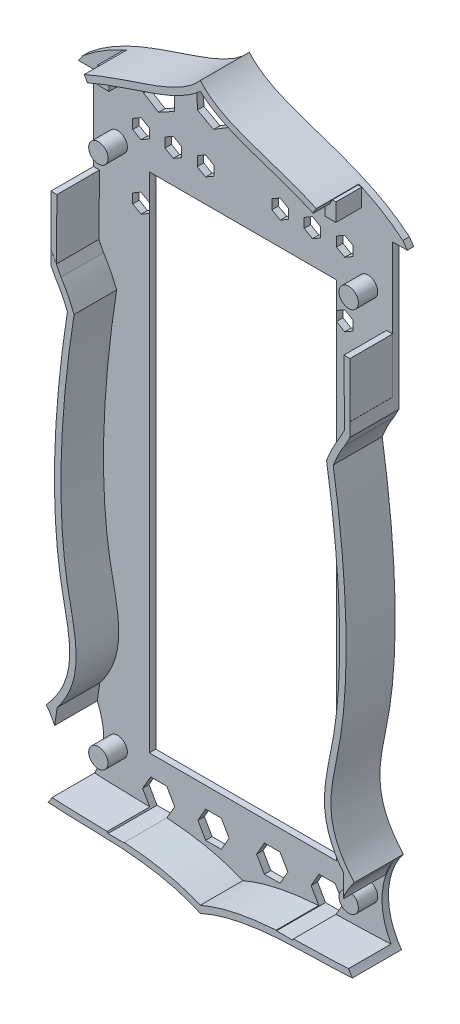
from build123d import *

# Parameters (mm, degrees)
CROQUIS1_R                = 1.5
SALIENTE_EXTRUIR1_DEPTH   = 7.6
SALIENTE_EXTRUIR1_2_DEPTH = 7.6
SALIENTE_EXTRUIR1_3_DEPTH = 7.6
SALIENTE_EXTRUIR1_4_DEPTH = 7.6
CROQUIS2_R                = 1.5
SALIENTE_EXTRUIR3_DEPTH   = 7.6
CROQUIS4_R                = 1.5
SALIENTE_EXTRUIR5_DEPTH   = 7.6
VACIADO2_START            = 1
VACIADO2_DEPTH            = 6.6
CROQUIS7_R                = 1.5
CROQUIS7_R_2              = 1.49758091
SALIENTE_EXTRUIR6_DEPTH   = 3
CROQUIS8_R                = 10.79265247
CROQUIS8_W                = 8.522992489
CROQUIS8_H                = 25
CORTAR_EXTRUIR2_DEPTH     = 7.6
CORTAR_EXTRUIR8_DEPTH     = 10
CROQUIS17_W               = 29
CROQUIS17_H               = 78
CORTAR_EXTRUIR9_DEPTH     = 10
CORTAR_EXTRUIR10_DEPTH    = 10
SALIENTE_EXTRUIR7_DEPTH   = 6.6
CROQUIS21_R               = 4.608681518
CORTAR_EXTRUIR12_DEPTH    = 6.6
SALIENTE_EXTRUIR17_DEPTH  = 6.6
CROQUIS34_W               = 1.681904755
CROQUIS34_H               = 2.752224693
SALIENTE_EXTRUIR33_DEPTH  = 4


# Read off the part's stored shape, not the designer's step: Vaciado2, Saliente-Extruir7
with BuildPart() as part:
    # Croquis1 → Saliente-Extruir1 (new body)
    with BuildSketch(Plane.XY):
        with Locations(Location((-19.405274038, 90.600927816, 0), (0, 0, 180))):
            Circle(CROQUIS1_R)
    extrude(amount=SALIENTE_EXTRUIR1_DEPTH)



with BuildPart() as body_2:
    # Croquis1 → Saliente-Extruir1 2 (new body)
    with BuildSketch(Plane.XY):
        with Locations(Location((19.405274038, 90.600927816, 0), (0, 0, 180))):
            Circle(CROQUIS1_R)
    extrude(amount=SALIENTE_EXTRUIR1_2_DEPTH)


with BuildPart() as body_3:
    # Croquis1 → Saliente-Extruir1 3 (new body)
    with BuildSketch(Plane.XY):
        with Locations(Location((-19.405274038, 9.399072184, 0), (0, 0, 180))):
            Circle(CROQUIS1_R)
    extrude(amount=SALIENTE_EXTRUIR1_3_DEPTH)


with BuildPart() as body_4:
    # Croquis1 → Saliente-Extruir1 4 (new body)
    with BuildSketch(Plane.XY):
        with Locations(Location((19.405274038, 9.399072184, 0), (0, 0, 180))):
            Circle(CROQUIS1_R)
    extrude(amount=SALIENTE_EXTRUIR1_4_DEPTH)


with BuildPart() as part_1:
    add(part.part)

    add(body_2.part)  # Saliente-Extruir3 merges body 2

    add(body_3.part)  # Saliente-Extruir3 merges body 3

    add(body_4.part)  # Saliente-Extruir3 merges body 4
    # Croquis2 → Saliente-Extruir3 (add)
    with BuildSketch(Plane.XY):
        with BuildLine():
            add(Edge.make_bspline(
                [(22.455196169, 74.097219878), (27.382232592, 83.429210928), (31.452765101, 90.387198949), (24.812211747, 99.439944374)],
                knots=[0.11050123, 0.11050123, 0.11050123, 0.11050123, 1, 1, 1, 1], degree=3))
            add(Edge.make_bspline(
                [(24.812211747, 99.439944374), (19.546217676, 103.828603356), (13.196463519, 105.432658494), (7.982243875, 107.269620004)],
                knots=[0.143181588, 0.143181588, 0.143181588, 0.143181588, 0.667562578, 0.667562578, 0.667562578, 0.667562578], degree=3))
            add(Edge.make_bspline(
                [(7.982243875, 107.269620004), (4.676628748, 108.434183097), (1.82739327, 109.692352969), (0, 111.812972587)],
                knots=[0.667562578, 0.667562578, 0.667562578, 0.667562578, 1, 1, 1, 1], degree=3))
            add(Edge.make_bspline(
                [(-24.812211747, 99.439944374), (-16.20777955, 106.610844709), (-4.709891542, 106.34732457), (0, 111.812972587)],
                knots=[0.143181588, 0.143181588, 0.143181588, 0.143181588, 1, 1, 1, 1], degree=3))
            add(Edge.make_bspline(
                [(-22.455196169, 74.097219878), (-27.382232592, 83.429210928), (-31.452765101, 90.387198949), (-24.812211747, 99.439944374)],
                knots=[0.11050123, 0.11050123, 0.11050123, 0.11050123, 1, 1, 1, 1], degree=3))
            add(Edge.make_bspline(
                [(-20.598197411, 70.500838285), (-21.096700712, 71.754083237), (-21.715700298, 72.952877102), (-22.455196169, 74.097219878)],
                knots=[0, 0, 0, 0, 0.196602836, 0.196602836, 0.196602836, 0.196602836], degree=3))
            add(Edge.make_bspline(
                [(-20.598197411, 70.500838285), (-22.806077443, 56.38679111), (-23.712592366, 31.871562699), (-16.869162928, 19.002842012), (-32.36, 9.399072184)],
                knots=[0, 0, 0, 0, 0.531906399, 1, 1, 1, 1], degree=3))
            add(Edge.make_bspline(
                [(-32.36, 9.399072184), (-32.279689687, 9.063611104), (-32.271111782, 8.890138206), (-32.283656965, 8.784699047)],
                knots=[0, 0, 0, 0, 0.017953112, 0.017953112, 0.017953112, 0.017953112], degree=3))
            add(Edge.make_bspline(
                [(-32.283656965, 8.784699047), (-32.244249538, 8.539703287), (-32.195140923, 8.305169613), (-32.136632945, 8.080637595)],
                knots=[0.019645113, 0.019645113, 0.019645113, 0.019645113, 0.043967189, 0.043967189, 0.043967189, 0.043967189], degree=3))
            add(Edge.make_bspline(
                [(-32.136632945, 8.080637595), (-29.836847948, -0.745088125), (-13.014518395, 5.882306702), (0, 0)],
                knots=[0.043967189, 0.043967189, 0.043967189, 0.043967189, 1, 1, 1, 1], degree=3))
            add(Edge.make_bspline(
                [(32.136632945, 8.080637595), (29.836847948, -0.745088125), (13.014518395, 5.882306702), (0, 0)],
                knots=[0.043967189, 0.043967189, 0.043967189, 0.043967189, 1, 1, 1, 1], degree=3))
            add(Edge.make_bspline(
                [(32.283656965, 8.784699047), (32.244249538, 8.539703287), (32.195140923, 8.305169613), (32.136632945, 8.080637595)],
                knots=[0.019645113, 0.019645113, 0.019645113, 0.019645113, 0.043967189, 0.043967189, 0.043967189, 0.043967189], degree=3))
            add(Edge.make_bspline(
                [(32.36, 9.399072184), (32.279689687, 9.063611104), (32.271111782, 8.890138206), (32.283656965, 8.784699047)],
                knots=[0, 0, 0, 0, 0.017953112, 0.017953112, 0.017953112, 0.017953112], degree=3))
            add(Edge.make_bspline(
                [(20.598197411, 70.500838285), (22.806077443, 56.38679111), (23.712592366, 31.871562699), (16.869162928, 19.002842012), (32.36, 9.399072184)],
                knots=[0, 0, 0, 0, 0.531906399, 1, 1, 1, 1], degree=3))
            add(Edge.make_bspline(
                [(20.598197411, 70.500838285), (21.096700712, 71.754083237), (21.715700298, 72.952877102), (22.455196169, 74.097219878)],
                knots=[0, 0, 0, 0, 0.196602836, 0.196602836, 0.196602836, 0.196602836], degree=3))
        make_face()
        with Locations((-19.405274038, 9.399072184)):
            Circle(CROQUIS2_R, mode=Mode.SUBTRACT)
        with Locations((19.405274038, 9.399072184)):
            Circle(CROQUIS2_R, mode=Mode.SUBTRACT)
        with Locations((-19.405274038, 90.600927816)):
            Circle(CROQUIS2_R, mode=Mode.SUBTRACT)
        with Locations((19.405274038, 90.600927816)):
            Circle(CROQUIS2_R, mode=Mode.SUBTRACT)
    extrude(amount=SALIENTE_EXTRUIR3_DEPTH)

    # Croquis4 → Saliente-Extruir5 (add)
    with BuildSketch(Plane(origin=(0, 0, 0), x_dir=(-1, 0, 0), z_dir=(0, 0, -1))):
        with Locations((19.405274038, 90.600927816)):
            Circle(CROQUIS4_R)
        with Locations((-19.405274038, 90.600927816)):
            Circle(CROQUIS4_R)
        with Locations((-19.405274038, 9.399072184)):
            Circle(CROQUIS4_R)
        with Locations((19.405274038, 9.399072184)):
            Circle(CROQUIS4_R)
    extrude(amount=-SALIENTE_EXTRUIR5_DEPTH)

    # Vaciado2 outline → Vaciado2 (cut)
    with BuildSketch(Plane.XY.offset(VACIADO2_START)):
        with BuildLine():
            add(Edge.make_bspline(
                [(-31.279137935, 8.896036325), (-31.279082677, 8.89183198), (-31.279037103, 8.887629763), (-31.279001254, 8.88342963), (-31.278975175, 8.879231542), (-31.27895891, 8.875035464), (-31.278952503, 8.870841364), (-31.278956, 8.866649215), (-31.278969444, 8.862458998), (-31.278992881, 8.858270694), (-31.279026354, 8.854084293), (-31.279069907, 8.849899788), (-31.279123586, 8.845717179), (-31.279187434, 8.84153647)],
                knots=[0.013264992, 0.013264992, 0.013264992, 0.013264992, 0.013264992, 0.013264992, 0.013264992, 0.013264992, 0.013264992, 0.013264992, 0.013264992, 0.013264992, 0.013264992, 0.013264992, 0.014365675, 0.014365675, 0.014365675, 0.014365675, 0.014365675, 0.014365675, 0.014365675, 0.014365675, 0.014365675, 0.014365675, 0.014365675, 0.014365675, 0.014365675, 0.014365675], degree=13))
            add(Edge.make_bspline(
                [(-31.279187434, 8.84153647), (-31.184785479, 8.304627377), (-31.052659192, 7.823290015), (-30.886295719, 7.39391882), (-30.688986145, 7.011623497), (-30.463051191, 6.669915736), (-30.209409951, 6.360597228), (-29.922493784, 6.075444188), (-29.59909728, 5.81414048), (-29.23769003, 5.574591877), (-28.837753494, 5.356716579), (-27.916545254, 4.942732127), (-27.386984927, 4.751241082), (-26.811924124, 4.58485512), (-26.193605714, 4.442894933), (-25.534827878, 4.323986191), (-24.838457409, 4.226117879), (-24.10724627, 4.146912092), (-23.343809085, 4.083820112), (-22.550655981, 4.034151108), (-21.730212019, 3.995031245), (-19.226585226, 3.901899168), (-17.472301083, 3.869713033), (-15.639455188, 3.845106125), (-13.744313735, 3.805138732), (-11.802225927, 3.726508076), (-9.828177295, 3.58568255), (-7.836867987, 3.358782953), (-5.84275346, 3.021348823), (-3.860690706, 2.54816815), (-1.907111986, 1.913562451), (-3.3e-08, 1.092906333)],
                knots=[0.023520973, 0.023520973, 0.023520973, 0.023520973, 0.023520973, 0.023520973, 0.023520973, 0.023520973, 0.023520973, 0.023520973, 0.023520973, 0.023520973, 0.25, 0.25, 0.25, 0.25, 0.25, 0.25, 0.25, 0.25, 0.25, 0.25, 0.5, 0.5, 0.5, 0.5, 0.5, 0.5, 0.5, 0.5, 0.5, 0.5, 0.99034932, 0.99034932, 0.99034932, 0.99034932, 0.99034932, 0.99034932, 0.99034932, 0.99034932, 0.99034932, 0.99034932, 0.99034932, 0.99034932], degree=11))
            add(Edge.make_bspline(
                [(31.279187161, 8.841536397), (31.184785479, 8.304627377), (31.052659192, 7.823290015), (30.886295719, 7.39391882), (30.688986145, 7.011623497), (30.463051191, 6.669915736), (30.209409951, 6.360597228), (29.922493784, 6.075444188), (29.59909728, 5.81414048), (29.23769003, 5.574591877), (28.837753494, 5.356716579), (27.916545254, 4.942732127), (27.386984927, 4.751241082), (26.811924124, 4.58485512), (26.193605714, 4.442894933), (25.534827878, 4.323986191), (24.838457409, 4.226117879), (24.10724627, 4.146912092), (23.343809085, 4.083820112), (22.550655981, 4.034151108), (21.730212019, 3.995031245), (19.226585226, 3.901899168), (17.472301083, 3.869713033), (15.639455188, 3.845106125), (13.744313735, 3.805138732), (11.802225927, 3.726508076), (9.828177295, 3.58568255), (7.836867987, 3.358782953), (5.84275346, 3.021348823), (3.860690706, 2.54816815), (1.907111986, 1.913562451), (-3.3e-08, 1.092906333)],
                knots=[0.023520973, 0.023520973, 0.023520973, 0.023520973, 0.023520973, 0.023520973, 0.023520973, 0.023520973, 0.023520973, 0.023520973, 0.023520973, 0.023520973, 0.25, 0.25, 0.25, 0.25, 0.25, 0.25, 0.25, 0.25, 0.25, 0.25, 0.5, 0.5, 0.5, 0.5, 0.5, 0.5, 0.5, 0.5, 0.5, 0.5, 0.99034932, 0.99034932, 0.99034932, 0.99034932, 0.99034932, 0.99034932, 0.99034932, 0.99034932, 0.99034932, 0.99034932, 0.99034932, 0.99034932], degree=11))
            add(Edge.make_bspline(
                [(31.279137935, 8.896036325), (31.279082677, 8.89183198), (31.279037103, 8.887629763), (31.279001254, 8.88342963), (31.278975175, 8.879231542), (31.27895891, 8.875035464), (31.278952503, 8.870841364), (31.278956, 8.866649215), (31.278969444, 8.862458998), (31.278992881, 8.858270694), (31.279026354, 8.854084293), (31.279069907, 8.849899788), (31.279123586, 8.845717179), (31.279187161, 8.841536397)],
                knots=[0.013264992, 0.013264992, 0.013264992, 0.013264992, 0.013264992, 0.013264992, 0.013264992, 0.013264992, 0.013264992, 0.013264992, 0.013264992, 0.013264992, 0.013264992, 0.013264992, 0.014365675, 0.014365675, 0.014365675, 0.014365675, 0.014365675, 0.014365675, 0.014365675, 0.014365675, 0.014365675, 0.014365675, 0.014365675, 0.014365675, 0.014365675, 0.014365675], degree=13))
            add(Edge.make_bspline(
                [(19.567958248, 70.616401553), (19.569188032, 70.608540065), (19.570417815, 70.600678576), (19.571647599, 70.592817088), (19.572877383, 70.5849556), (19.574107166, 70.577094111), (19.57533695, 70.569232623), (19.576566733, 70.561371134), (19.577796517, 70.553509646), (19.5790263, 70.545648157), (19.580256084, 70.537786669), (19.581485867, 70.529925181), (19.582715651, 70.522063692), (19.585835033, 70.502122795), (19.587724632, 70.490043387), (19.589614231, 70.477963979), (19.591503829, 70.46588457), (19.593393428, 70.453805162), (19.595283026, 70.441725753), (19.597172625, 70.429646345), (19.599062224, 70.417566936), (19.600951823, 70.405487528), (19.602841421, 70.39340812), (19.60473102, 70.381328711), (19.606620619, 70.369249303), (19.608746417, 70.355659968), (19.608981556, 70.35415678), (19.609226992, 70.35258813), (19.609423458, 70.351331085), (19.609767924, 70.349131451), (19.609802434, 70.348907705), (19.610299479, 70.345732462), (19.610306849, 70.345685341), (19.610674178, 70.343336123), (19.610858026, 70.342161332), (19.611105269, 70.340580312), (19.611338781, 70.339087249), (19.611808654, 70.336082674), (19.612043576, 70.334580396), (19.612278484, 70.333078127), (19.612513377, 70.331575867), (19.612748257, 70.330073616), (19.612983122, 70.328571375), (19.613217973, 70.327069141), (19.61345281, 70.325566918), (19.613687632, 70.324064702), (19.613922441, 70.322562497), (19.614157235, 70.3210603), (19.614392015, 70.319558112), (19.615096312, 70.315051576), (19.615565786, 70.312047255), (19.616035204, 70.30904297), (19.616504564, 70.30603872), (19.616973869, 70.303034508), (19.617443115, 70.300030329), (19.617912306, 70.297026191), (19.618381438, 70.294022085), (19.618850515, 70.291018018), (19.619319534, 70.288013985), (19.619788496, 70.28500999), (19.620257402, 70.28200603), (19.621663947, 70.272994259), (19.622601417, 70.266986557), (19.623538659, 70.260979), (19.624475673, 70.254971587), (19.625412459, 70.248964321), (19.626349018, 70.242957197), (19.627285349, 70.236950221), (19.628221452, 70.230943388), (19.629157328, 70.224936702), (19.630092976, 70.218930159), (19.631028396, 70.212923763), (19.631963589, 70.206917511), (19.636638412, 70.176886982), (19.640374627, 70.152864884), (19.644107197, 70.128845116), (19.647836121, 70.104827678), (19.6515614, 70.080812579), (19.655283032, 70.056799815), (19.659001016, 70.032789396), (19.662715352, 70.00878132), (19.66642604, 69.984775594), (19.670133079, 69.960772218), (19.673836467, 69.936771198), (19.677536205, 69.912772536), (19.696016636, 69.792791032), (19.71074256, 69.696843609), (19.72541002, 69.600934174), (19.740018974, 69.505062932), (19.754569381, 69.40923009), (19.769061197, 69.313435856), (19.783494381, 69.217680434), (19.797868891, 69.121964034), (19.812184684, 69.026286858), (19.826441718, 68.930649117), (19.840639951, 68.835051014), (19.854779341, 68.739492757), (19.897020856, 68.452938145), (19.924946323, 68.262061945), (19.952635913, 68.071347607), (19.980089287, 67.880796785), (20.007306111, 67.690411134), (20.034286047, 67.500192307), (20.061028761, 67.310141961), (20.087533915, 67.120261746), (20.113801174, 66.93055332), (20.1398302, 66.741018334), (20.165620659, 66.551658445), (20.191172214, 66.362475306), (20.267109156, 65.795461101), (20.3167768, 65.418165209), (20.365484792, 65.041596166), (20.413230463, 64.665767242), (20.460011147, 64.290691714), (20.505824175, 63.916382846), (20.550666881, 63.542853919), (20.594536595, 63.170118196), (20.637430651, 62.798188955), (20.679346381, 62.427079463), (20.720281118, 62.056802995), (20.760232192, 61.687372821), (20.877126429, 60.581661), (20.951110793, 59.847958329), (21.021128763, 59.117800542), (21.087159164, 58.391294115), (21.149180916, 57.668545663), (21.207173033, 56.949661937), (21.261114624, 56.234749827), (21.310984892, 55.523916355), (21.356763133, 54.817268687), (21.398428738, 54.114914121), (21.435961193, 53.416960094), (21.469340077, 52.72351418), (21.556955034, 50.65702391), (21.598668451, 49.297827409), (21.62352549, 47.957956805), (21.631366857, 46.638277208), (21.622034977, 45.339657005), (21.595375171, 44.062968234), (21.551236844, 42.809086984), (21.489474664, 41.578893761), (21.409949749, 40.373273888), (21.312530846, 39.193117874), (21.197095517, 38.03932181), (21.063531322, 36.912787744), (20.892762707, 35.677128611), (20.873503561, 35.540273297), (20.853959386, 35.403859908), (20.834130008, 35.267890223), (20.814015253, 35.132366021), (20.793614946, 34.997289082), (20.772928915, 34.862661184), (20.751956986, 34.728484108), (20.730698984, 34.594759631), (20.709154736, 34.461489534), (20.687324067, 34.328675595), (20.665206804, 34.196319595), (20.637201766, 34.03144924), (20.631583088, 33.998504951), (20.625945459, 33.965585522), (20.620291163, 33.932698117), (20.614619336, 33.899844604), (20.608928032, 33.867013115), (20.603218005, 33.83420241), (20.597492064, 33.801430142), (20.591750372, 33.76870411), (20.585988195, 33.735995571), (20.580202507, 33.703276398), (20.574401595, 33.670598507), (20.562761439, 33.605272254), (20.556922988, 33.572628687), (20.551066486, 33.540004558), (20.545192255, 33.507399747), (20.539300616, 33.474814131), (20.533391893, 33.442247592), (20.527466407, 33.409700006), (20.52152448, 33.377171255), (20.515566435, 33.344661216), (20.509592593, 33.312169769), (20.503603277, 33.279696793), (20.497598808, 33.247242167), (20.479540912, 33.149932976), (20.467442963, 33.0851331), (20.45528827, 33.020405176), (20.443079439, 32.955748236), (20.430819077, 32.891161314), (20.418509791, 32.826643442), (20.406154186, 32.762193655), (20.39375487, 32.697810985), (20.381314449, 32.633494466), (20.368835529, 32.56924313), (20.356320717, 32.505056011), (20.34377262, 32.440932142), (20.28087874, 32.120624214), (20.23007337, 31.865374194), (20.178946026, 31.611058787), (20.12766613, 31.3576159), (20.07640435, 31.104983095), (20.025332719, 30.853097621), (19.974624751, 30.601896449), (19.92445556, 30.351316306), (19.875001975, 30.101293706), (19.826442661, 29.851764988), (19.778958232, 29.602666346), (19.732731373, 29.353933866), (19.598378113, 28.608642943), (19.514577669, 28.112993447), (19.438029651, 27.618040232), (19.370246083, 27.123283135), (19.312779083, 26.628229959), (19.267227623, 26.132405529), (19.235238335, 25.635371124), (19.218499772, 25.136748959), (19.21872948, 24.636246286), (19.237653339, 24.133673808), (19.276976488, 23.628952977), (19.338345294, 23.122106848), (19.589452338, 21.617973518), (19.845836756, 20.61493075), (20.204002349, 19.604874933), (20.674307426, 18.589103249), (21.264980322, 17.570068405), (21.981859608, 16.5467718), (22.831920865, 15.515155122), (23.824450535, 14.470427225), (24.969383903, 13.408087735), (26.276568567, 12.323698346), (27.756846496, 11.212883515), (29.420782705, 10.071628583), (31.279137935, 8.896036325)],
                knots=[-0.003393214, -0.003393214, -0.003393214, -0.003393214, -0.003393214, -0.003393214, -0.003393214, -0.003393214, -0.003393214, -0.003393214, -0.003393214, -0.003393214, -0.003393214, -0.003393214, -0.002109375, -0.002109375, -0.002109375, -0.002109375, -0.002109375, -0.002109375, -0.002109375, -0.002109375, -0.002109375, -0.002109375, -0.002109375, -0.002109375, -0.000136719, -0.000136719, -0.000136719, -0.000136719, -0.000136719, -0.000136719, -0.000136719, -0.000136719, -0.000136719, -0.000136719, -0.000136719, -0.000136719, 0.000109863, 0.000109863, 0.000109863, 0.000109863, 0.000109863, 0.000109863, 0.000109863, 0.000109863, 0.000109863, 0.000109863, 0.000109863, 0.000109863, 0.000356445, 0.000356445, 0.000356445, 0.000356445, 0.000356445, 0.000356445, 0.000356445, 0.000356445, 0.000356445, 0.000356445, 0.000356445, 0.000356445, 0.000849609, 0.000849609, 0.000849609, 0.000849609, 0.000849609, 0.000849609, 0.000849609, 0.000849609, 0.000849609, 0.000849609, 0.000849609, 0.000849609, 0.001835937, 0.001835937, 0.001835937, 0.001835937, 0.001835937, 0.001835937, 0.001835937, 0.001835937, 0.001835937, 0.001835937, 0.001835937, 0.001835937, 0.00578125, 0.00578125, 0.00578125, 0.00578125, 0.00578125, 0.00578125, 0.00578125, 0.00578125, 0.00578125, 0.00578125, 0.00578125, 0.00578125, 0.0215625, 0.0215625, 0.0215625, 0.0215625, 0.0215625, 0.0215625, 0.0215625, 0.0215625, 0.0215625, 0.0215625, 0.0215625, 0.0215625, 0.053125, 0.053125, 0.053125, 0.053125, 0.053125, 0.053125, 0.053125, 0.053125, 0.053125, 0.053125, 0.053125, 0.053125, 0.11625, 0.11625, 0.11625, 0.11625, 0.11625, 0.11625, 0.11625, 0.11625, 0.11625, 0.11625, 0.11625, 0.11625, 0.2425, 0.2425, 0.2425, 0.2425, 0.2425, 0.2425, 0.2425, 0.2425, 0.2425, 0.2425, 0.2425, 0.2425, 0.495, 0.495, 0.495, 0.495, 0.495, 0.495, 0.495, 0.495, 0.495, 0.495, 0.495, 0.495, 0.5265625, 0.5265625, 0.5265625, 0.5265625, 0.5265625, 0.5265625, 0.5265625, 0.5265625, 0.5265625, 0.5265625, 0.5265625, 0.5265625, 0.534453125, 0.534453125, 0.534453125, 0.534453125, 0.534453125, 0.534453125, 0.534453125, 0.534453125, 0.534453125, 0.534453125, 0.534453125, 0.534453125, 0.54234375, 0.54234375, 0.54234375, 0.54234375, 0.54234375, 0.54234375, 0.54234375, 0.54234375, 0.54234375, 0.54234375, 0.54234375, 0.54234375, 0.558125, 0.558125, 0.558125, 0.558125, 0.558125, 0.558125, 0.558125, 0.558125, 0.558125, 0.558125, 0.558125, 0.558125, 0.62125, 0.62125, 0.62125, 0.62125, 0.62125, 0.62125, 0.62125, 0.62125, 0.62125, 0.62125, 0.62125, 0.62125, 0.7475, 0.7475, 0.7475, 0.7475, 0.7475, 0.7475, 0.7475, 0.7475, 0.7475, 0.7475, 0.7475, 0.7475, 0.994417885, 0.994417885, 0.994417885, 0.994417885, 0.994417885, 0.994417885, 0.994417885, 0.994417885, 0.994417885, 0.994417885, 0.994417885, 0.994417885, 0.994417885, 0.994417885], degree=13))
            add(Edge.make_bspline(
                [(19.567958248, 70.616401553), (19.579045468, 70.644274993), (19.590132687, 70.672148433), (19.601219906, 70.700021872), (19.612307126, 70.727895312), (19.623394345, 70.755768752), (19.634481565, 70.783642192), (19.645568784, 70.811515632), (19.656656003, 70.839389071), (19.667829842, 70.867480272), (19.667916461, 70.867698034), (19.66800308, 70.867915795), (19.668089698, 70.868133556), (19.668176317, 70.868351317), (19.668262936, 70.868569079), (19.668349555, 70.86878684), (19.668436174, 70.869004601), (19.668566102, 70.869331243), (19.668609412, 70.869440124), (19.668652721, 70.869549004), (19.668696031, 70.869657885), (19.66873934, 70.869766765), (19.66878265, 70.869875646), (19.668825959, 70.869984527), (19.668869269, 70.870093407), (19.668955887, 70.870311169), (19.669001312, 70.870425367), (19.669031059, 70.870500154), (19.669107506, 70.870692342), (19.669121553, 70.870727646), (19.669186211, 70.870890195), (19.669224618, 70.870986741), (19.66927122, 70.871103888), (19.669498271, 70.871674635), (19.669679924, 70.872131227), (19.669861588, 70.872587814), (19.670043264, 70.873044397), (19.670224951, 70.873500974), (19.670406649, 70.873957545), (19.670588359, 70.874414112), (19.670770081, 70.874870674), (19.671315279, 70.876240344), (19.671678791, 70.877153436), (19.672042349, 70.878066509), (19.672405952, 70.878979561), (19.672769602, 70.879892592), (19.673133297, 70.880805604), (19.673497038, 70.881718594), (19.673860825, 70.882631565), (19.674952324, 70.885370415), (19.675680173, 70.887196233), (19.676408206, 70.88902197), (19.677136423, 70.890847626), (19.677864823, 70.8926732), (19.678593406, 70.894498692), (19.679322173, 70.896324103), (19.680051124, 70.898149432), (19.682238526, 70.903625174), (19.683697529, 70.907275343), (19.685157265, 70.910925185), (19.686617736, 70.914574701), (19.688078941, 70.91822389), (19.68954088, 70.921872753), (19.691003553, 70.92552129), (19.69246696, 70.9291695), (19.696859384, 70.940113151), (19.699790603, 70.947407612), (19.702724759, 70.954700767), (19.70566185, 70.961992615), (19.708601878, 70.969283157), (19.711544842, 70.976572392), (19.714490742, 70.98386032), (19.717439578, 70.99114694), (19.726294894, 71.01300288), (19.732210182, 71.027568276), (19.738137213, 71.042128441), (19.744075986, 71.056683373), (19.750026502, 71.071233071), (19.75598876, 71.085777533), (19.761962759, 71.100316757), (19.767948499, 71.114850741), (19.797935899, 71.18749446), (19.822113666, 71.245525579), (19.846479243, 71.303472744), (19.871032591, 71.361335854), (19.895773672, 71.419114809), (19.920702448, 71.47680951), (19.945818881, 71.534419857), (19.971122933, 71.59194575), (20.047597831, 71.764269768), (20.09933147, 71.878814202), (20.151815085, 71.993019633), (20.205048281, 72.106885307), (20.259030661, 72.220410466), (20.313761829, 72.333594355), (20.369241388, 72.446436216), (20.425468943, 72.558935295), (20.594175327, 72.891033663), (20.708781406, 73.10965553), (20.826258841, 73.326950938), (20.946603939, 73.54291465), (21.069812801, 73.757541688), (21.195881327, 73.970827336), (21.324805213, 74.182767133), (21.456579951, 74.393356882), (21.59120083, 74.602592641)],
                knots=[-0.013284202, -0.013284202, -0.013284202, -0.013284202, -0.013284202, -0.013284202, -0.013284202, -0.013284202, -0.013284202, -0.013284202, -0.000166262, -0.000166262, -0.000166262, -0.000166262, -0.000166262, -0.000166262, -0.000166262, -0.000166262, -6.3778e-05, -6.3778e-05, -6.3778e-05, -6.3778e-05, -6.3778e-05, -6.3778e-05, -6.3778e-05, -6.3778e-05, -1.2536e-05, -1.2536e-05, -1.2536e-05, -1.2536e-05, -1.2536e-05, -1.2536e-05, -1.2536e-05, -1.2536e-05, 3.8706e-05, 3.8706e-05, 3.8706e-05, 3.8706e-05, 3.8706e-05, 3.8706e-05, 3.8706e-05, 3.8706e-05, 0.000243674, 0.000243674, 0.000243674, 0.000243674, 0.000243674, 0.000243674, 0.000243674, 0.000243674, 0.000653609, 0.000653609, 0.000653609, 0.000653609, 0.000653609, 0.000653609, 0.000653609, 0.000653609, 0.00147348, 0.00147348, 0.00147348, 0.00147348, 0.00147348, 0.00147348, 0.00147348, 0.00147348, 0.003113223, 0.003113223, 0.003113223, 0.003113223, 0.003113223, 0.003113223, 0.003113223, 0.003113223, 0.006392708, 0.006392708, 0.006392708, 0.006392708, 0.006392708, 0.006392708, 0.006392708, 0.006392708, 0.012951678, 0.012951678, 0.012951678, 0.012951678, 0.012951678, 0.012951678, 0.012951678, 0.012951678, 0.039187558, 0.039187558, 0.039187558, 0.039187558, 0.039187558, 0.039187558, 0.039187558, 0.039187558, 0.091659317, 0.091659317, 0.091659317, 0.091659317, 0.091659317, 0.091659317, 0.091659317, 0.091659317, 0.19455916, 0.19455916, 0.19455916, 0.19455916, 0.19455916, 0.19455916, 0.19455916, 0.19455916, 0.19455916, 0.19455916], degree=9))
            add(Edge.make_bspline(
                [(21.59120083, 74.602592641), (22.237406848, 75.826265296), (22.87060242, 77.016133512), (23.483767035, 78.17502857), (24.069930945, 79.305701802), (24.622190883, 80.410798237), (25.133730296, 81.49283357), (25.597900415, 82.554173128), (26.008361267, 83.597063493), (26.359224797, 84.623819433), (27.01071755, 86.933647586), (27.270002002, 88.208314797), (27.411534742, 89.467095062), (27.425386359, 90.718422627), (27.300895943, 91.969967119), (27.031363183, 93.241083758), (26.592140795, 94.547787124), (25.965600165, 95.897126708), (25.133077279, 97.296088337), (24.077939107, 98.7497294)],
                knots=[0.111721724, 0.111721724, 0.111721724, 0.111721724, 0.111721724, 0.111721724, 0.111721724, 0.111721724, 0.111721724, 0.111721724, 0.111721724, 0.5, 0.5, 0.5, 0.5, 0.5, 0.5, 0.5, 0.5, 0.5, 0.99663037, 0.99663037, 0.99663037, 0.99663037, 0.99663037, 0.99663037, 0.99663037, 0.99663037, 0.99663037, 0.99663037, 0.99663037], degree=10))
            add(Edge.make_bspline(
                [(24.077939107, 98.7497294), (22.390935929, 100.141131222), (20.617936856, 101.324840103), (18.776835876, 102.332315221), (16.886907628, 103.19348156), (14.966264396, 103.934590803), (13.043057518, 104.58860857), (11.129954467, 105.176474345), (9.261728652, 105.742686704), (7.448009181, 106.300216819), (5.716147835, 106.900541257), (4.086296203, 107.561491253), (2.567617253, 108.330264635), (1.191415892, 109.25577365), (-3.5e-07, 110.371909358)],
                knots=[0.146430111, 0.146430111, 0.146430111, 0.146430111, 0.146430111, 0.146430111, 0.146430111, 0.146430111, 0.146430111, 0.146430111, 0.146430111, 0.146430111, 0.146430111, 0.146430111, 0.146430111, 0.961040136, 0.961040136, 0.961040136, 0.961040136, 0.961040136, 0.961040136, 0.961040136, 0.961040136, 0.961040136, 0.961040136, 0.961040136, 0.961040136, 0.961040136, 0.961040136, 0.961040136], degree=14))
            add(Edge.make_bspline(
                [(-24.077939101, 98.749729452), (-22.390935929, 100.141131222), (-20.617936856, 101.324840103), (-18.776835876, 102.332315221), (-16.886907628, 103.19348156), (-14.966264396, 103.934590802), (-13.043057518, 104.588608571), (-11.129954466, 105.176474345), (-9.261728652, 105.742686705), (-7.448009181, 106.300216819), (-5.716147835, 106.900541257), (-4.086296203, 107.561491253), (-2.567617253, 108.330264635), (-1.191415892, 109.25577365), (-3.5e-07, 110.371909358)],
                knots=[0.146430111, 0.146430111, 0.146430111, 0.146430111, 0.146430111, 0.146430111, 0.146430111, 0.146430111, 0.146430111, 0.146430111, 0.146430111, 0.146430111, 0.146430111, 0.146430111, 0.146430111, 0.961040136, 0.961040136, 0.961040136, 0.961040136, 0.961040136, 0.961040136, 0.961040136, 0.961040136, 0.961040136, 0.961040136, 0.961040136, 0.961040136, 0.961040136, 0.961040136, 0.961040136], degree=14))
            add(Edge.make_bspline(
                [(-21.591201072, 74.602592627), (-22.237406848, 75.826265296), (-22.87060242, 77.016133512), (-23.483767035, 78.17502857), (-24.069930945, 79.305701802), (-24.622190883, 80.410798237), (-25.133730296, 81.49283357), (-25.597900415, 82.554173128), (-26.008361267, 83.597063493), (-26.359224797, 84.623819433), (-27.01071755, 86.933647586), (-27.270002002, 88.208314797), (-27.411534742, 89.467095062), (-27.425386359, 90.718422627), (-27.300895943, 91.969967119), (-27.031363183, 93.241083758), (-26.592140795, 94.547787124), (-25.965600165, 95.897126708), (-25.133077279, 97.296088337), (-24.077939101, 98.749729452)],
                knots=[0.111721724, 0.111721724, 0.111721724, 0.111721724, 0.111721724, 0.111721724, 0.111721724, 0.111721724, 0.111721724, 0.111721724, 0.111721724, 0.5, 0.5, 0.5, 0.5, 0.5, 0.5, 0.5, 0.5, 0.5, 0.99663037, 0.99663037, 0.99663037, 0.99663037, 0.99663037, 0.99663037, 0.99663037, 0.99663037, 0.99663037, 0.99663037, 0.99663037], degree=10))
            add(Edge.make_bspline(
                [(-19.567958248, 70.616401553), (-19.579045468, 70.644274993), (-19.590132687, 70.672148433), (-19.601219906, 70.700021872), (-19.612307126, 70.727895312), (-19.623394345, 70.755768752), (-19.634481565, 70.783642192), (-19.645568784, 70.811515632), (-19.656656003, 70.839389071), (-19.667829842, 70.867480272), (-19.667916461, 70.867698034), (-19.66800308, 70.867915795), (-19.668089698, 70.868133556), (-19.668176317, 70.868351317), (-19.668262936, 70.868569079), (-19.668349555, 70.86878684), (-19.668436174, 70.869004601), (-19.668566102, 70.869331243), (-19.668609412, 70.869440124), (-19.668652721, 70.869549004), (-19.668696031, 70.869657885), (-19.66873934, 70.869766765), (-19.66878265, 70.869875646), (-19.668825959, 70.869984527), (-19.668869269, 70.870093407), (-19.668955887, 70.870311169), (-19.669001312, 70.870425367), (-19.669031059, 70.870500154), (-19.669107506, 70.870692342), (-19.669121553, 70.870727646), (-19.669186211, 70.870890195), (-19.669224618, 70.870986741), (-19.66927122, 70.871103888), (-19.669498271, 70.871674635), (-19.669679924, 70.872131227), (-19.669861588, 70.872587814), (-19.670043264, 70.873044397), (-19.670224951, 70.873500974), (-19.670406649, 70.873957545), (-19.670588359, 70.874414112), (-19.670770081, 70.874870674), (-19.671315279, 70.876240344), (-19.671678791, 70.877153436), (-19.672042349, 70.878066509), (-19.672405952, 70.878979561), (-19.672769602, 70.879892592), (-19.673133297, 70.880805604), (-19.673497038, 70.881718594), (-19.673860825, 70.882631565), (-19.674952324, 70.885370415), (-19.675680173, 70.887196233), (-19.676408206, 70.88902197), (-19.677136423, 70.890847626), (-19.677864823, 70.8926732), (-19.678593406, 70.894498692), (-19.679322173, 70.896324103), (-19.680051124, 70.898149432), (-19.682238526, 70.903625174), (-19.683697529, 70.907275343), (-19.685157265, 70.910925185), (-19.686617736, 70.914574701), (-19.688078941, 70.91822389), (-19.68954088, 70.921872753), (-19.691003553, 70.92552129), (-19.69246696, 70.9291695), (-19.696859384, 70.940113151), (-19.699790603, 70.947407612), (-19.702724759, 70.954700767), (-19.70566185, 70.961992615), (-19.708601878, 70.969283157), (-19.711544842, 70.976572392), (-19.714490742, 70.98386032), (-19.717439578, 70.99114694), (-19.726294894, 71.01300288), (-19.732210182, 71.027568276), (-19.738137213, 71.042128441), (-19.744075986, 71.056683373), (-19.750026502, 71.071233071), (-19.75598876, 71.085777533), (-19.761962759, 71.100316757), (-19.767948499, 71.114850741), (-19.797935899, 71.18749446), (-19.822113666, 71.245525579), (-19.846479243, 71.303472744), (-19.871032591, 71.361335854), (-19.895773672, 71.419114809), (-19.920702448, 71.47680951), (-19.945818881, 71.534419857), (-19.971122933, 71.59194575), (-20.047597831, 71.764269768), (-20.09933147, 71.878814202), (-20.151815085, 71.993019633), (-20.205048281, 72.106885307), (-20.259030661, 72.220410466), (-20.313761829, 72.333594355), (-20.369241388, 72.446436216), (-20.425468943, 72.558935295), (-20.594175327, 72.891033663), (-20.708781406, 73.10965553), (-20.826258841, 73.326950938), (-20.946603939, 73.54291465), (-21.069812801, 73.757541688), (-21.195881327, 73.970827336), (-21.324805213, 74.182767133), (-21.456579951, 74.393356882), (-21.591201072, 74.602592627)],
                knots=[-0.013284202, -0.013284202, -0.013284202, -0.013284202, -0.013284202, -0.013284202, -0.013284202, -0.013284202, -0.013284202, -0.013284202, -0.000166262, -0.000166262, -0.000166262, -0.000166262, -0.000166262, -0.000166262, -0.000166262, -0.000166262, -6.3778e-05, -6.3778e-05, -6.3778e-05, -6.3778e-05, -6.3778e-05, -6.3778e-05, -6.3778e-05, -6.3778e-05, -1.2536e-05, -1.2536e-05, -1.2536e-05, -1.2536e-05, -1.2536e-05, -1.2536e-05, -1.2536e-05, -1.2536e-05, 3.8706e-05, 3.8706e-05, 3.8706e-05, 3.8706e-05, 3.8706e-05, 3.8706e-05, 3.8706e-05, 3.8706e-05, 0.000243674, 0.000243674, 0.000243674, 0.000243674, 0.000243674, 0.000243674, 0.000243674, 0.000243674, 0.000653609, 0.000653609, 0.000653609, 0.000653609, 0.000653609, 0.000653609, 0.000653609, 0.000653609, 0.00147348, 0.00147348, 0.00147348, 0.00147348, 0.00147348, 0.00147348, 0.00147348, 0.00147348, 0.003113223, 0.003113223, 0.003113223, 0.003113223, 0.003113223, 0.003113223, 0.003113223, 0.003113223, 0.006392708, 0.006392708, 0.006392708, 0.006392708, 0.006392708, 0.006392708, 0.006392708, 0.006392708, 0.012951678, 0.012951678, 0.012951678, 0.012951678, 0.012951678, 0.012951678, 0.012951678, 0.012951678, 0.039187558, 0.039187558, 0.039187558, 0.039187558, 0.039187558, 0.039187558, 0.039187558, 0.039187558, 0.091659317, 0.091659317, 0.091659317, 0.091659317, 0.091659317, 0.091659317, 0.091659317, 0.091659317, 0.19455916, 0.19455916, 0.19455916, 0.19455916, 0.19455916, 0.19455916, 0.19455916, 0.19455916, 0.19455916, 0.19455916], degree=9))
            add(Edge.make_bspline(
                [(-19.567958248, 70.616401553), (-19.569188032, 70.608540065), (-19.570417815, 70.600678576), (-19.571647599, 70.592817088), (-19.572877383, 70.5849556), (-19.574107166, 70.577094111), (-19.57533695, 70.569232623), (-19.576566733, 70.561371134), (-19.577796517, 70.553509646), (-19.5790263, 70.545648157), (-19.580256084, 70.537786669), (-19.581485867, 70.529925181), (-19.582715651, 70.522063692), (-19.585835033, 70.502122795), (-19.587724632, 70.490043387), (-19.589614231, 70.477963979), (-19.591503829, 70.46588457), (-19.593393428, 70.453805162), (-19.595283026, 70.441725753), (-19.597172625, 70.429646345), (-19.599062224, 70.417566936), (-19.600951823, 70.405487528), (-19.602841421, 70.39340812), (-19.60473102, 70.381328711), (-19.606620619, 70.369249303), (-19.608746417, 70.355659968), (-19.608981556, 70.35415678), (-19.609226992, 70.35258813), (-19.609423458, 70.351331085), (-19.609767924, 70.349131451), (-19.609802434, 70.348907705), (-19.610299479, 70.345732462), (-19.610306849, 70.345685341), (-19.610674178, 70.343336123), (-19.610858026, 70.342161332), (-19.611105269, 70.340580312), (-19.611338781, 70.339087249), (-19.611808654, 70.336082674), (-19.612043576, 70.334580396), (-19.612278484, 70.333078127), (-19.612513377, 70.331575867), (-19.612748257, 70.330073616), (-19.612983122, 70.328571375), (-19.613217973, 70.327069141), (-19.61345281, 70.325566918), (-19.613687632, 70.324064702), (-19.613922441, 70.322562497), (-19.614157235, 70.3210603), (-19.614392015, 70.319558112), (-19.615096312, 70.315051576), (-19.615565786, 70.312047255), (-19.616035204, 70.30904297), (-19.616504564, 70.30603872), (-19.616973869, 70.303034508), (-19.617443115, 70.300030329), (-19.617912306, 70.297026191), (-19.618381438, 70.294022085), (-19.618850515, 70.291018018), (-19.619319534, 70.288013985), (-19.619788496, 70.28500999), (-19.620257402, 70.28200603), (-19.621663947, 70.272994259), (-19.622601417, 70.266986557), (-19.623538659, 70.260979), (-19.624475673, 70.254971587), (-19.625412459, 70.248964321), (-19.626349018, 70.242957197), (-19.627285349, 70.236950221), (-19.628221452, 70.230943388), (-19.629157328, 70.224936702), (-19.630092976, 70.218930159), (-19.631028396, 70.212923763), (-19.631963589, 70.206917511), (-19.636638412, 70.176886982), (-19.640374627, 70.152864884), (-19.644107197, 70.128845116), (-19.647836121, 70.104827678), (-19.6515614, 70.080812579), (-19.655283032, 70.056799815), (-19.659001016, 70.032789396), (-19.662715352, 70.00878132), (-19.66642604, 69.984775594), (-19.670133079, 69.960772218), (-19.673836467, 69.936771198), (-19.677536205, 69.912772536), (-19.696016636, 69.792791032), (-19.71074256, 69.696843609), (-19.72541002, 69.600934174), (-19.740018974, 69.505062932), (-19.754569381, 69.40923009), (-19.769061197, 69.313435856), (-19.783494381, 69.217680434), (-19.797868891, 69.121964034), (-19.812184684, 69.026286858), (-19.826441718, 68.930649117), (-19.840639951, 68.835051014), (-19.854779341, 68.739492757), (-19.897020856, 68.452938145), (-19.924946323, 68.262061945), (-19.952635913, 68.071347607), (-19.980089287, 67.880796785), (-20.007306111, 67.690411134), (-20.034286047, 67.500192307), (-20.061028761, 67.310141961), (-20.087533915, 67.120261746), (-20.113801174, 66.93055332), (-20.1398302, 66.741018334), (-20.165620659, 66.551658445), (-20.191172214, 66.362475306), (-20.267109156, 65.795461101), (-20.3167768, 65.418165209), (-20.365484792, 65.041596166), (-20.413230463, 64.665767242), (-20.460011147, 64.290691714), (-20.505824175, 63.916382846), (-20.550666881, 63.542853919), (-20.594536595, 63.170118196), (-20.637430651, 62.798188955), (-20.679346381, 62.427079463), (-20.720281118, 62.056802995), (-20.760232192, 61.687372821), (-20.877126429, 60.581661), (-20.951110793, 59.847958329), (-21.021128763, 59.117800542), (-21.087159164, 58.391294115), (-21.149180916, 57.668545663), (-21.207173033, 56.949661937), (-21.261114624, 56.234749827), (-21.310984892, 55.523916355), (-21.356763133, 54.817268687), (-21.398428738, 54.114914121), (-21.435961193, 53.416960094), (-21.469340077, 52.72351418), (-21.556955034, 50.65702391), (-21.598668451, 49.297827409), (-21.62352549, 47.957956805), (-21.631366857, 46.638277208), (-21.622034977, 45.339657005), (-21.595375171, 44.062968234), (-21.551236844, 42.809086984), (-21.489474664, 41.578893761), (-21.409949749, 40.373273888), (-21.312530846, 39.193117874), (-21.197095517, 38.03932181), (-21.063531322, 36.912787744), (-20.892762707, 35.677128611), (-20.873503561, 35.540273297), (-20.853959386, 35.403859908), (-20.834130008, 35.267890223), (-20.814015253, 35.132366021), (-20.793614946, 34.997289082), (-20.772928915, 34.862661184), (-20.751956986, 34.728484108), (-20.730698984, 34.594759631), (-20.709154736, 34.461489534), (-20.687324067, 34.328675595), (-20.665206804, 34.196319595), (-20.637201766, 34.03144924), (-20.631583088, 33.998504951), (-20.625945459, 33.965585522), (-20.620291163, 33.932698117), (-20.614619336, 33.899844604), (-20.608928032, 33.867013115), (-20.603218005, 33.83420241), (-20.597492064, 33.801430142), (-20.591750372, 33.76870411), (-20.585988195, 33.735995571), (-20.580202507, 33.703276398), (-20.574401595, 33.670598507), (-20.562761439, 33.605272254), (-20.556922988, 33.572628687), (-20.551066486, 33.540004558), (-20.545192255, 33.507399747), (-20.539300616, 33.474814131), (-20.533391893, 33.442247592), (-20.527466407, 33.409700006), (-20.52152448, 33.377171255), (-20.515566435, 33.344661216), (-20.509592593, 33.312169769), (-20.503603277, 33.279696793), (-20.497598808, 33.247242167), (-20.479540912, 33.149932976), (-20.467442963, 33.0851331), (-20.45528827, 33.020405176), (-20.443079439, 32.955748236), (-20.430819077, 32.891161314), (-20.418509791, 32.826643442), (-20.406154186, 32.762193655), (-20.39375487, 32.697810985), (-20.381314449, 32.633494466), (-20.368835529, 32.56924313), (-20.356320717, 32.505056011), (-20.34377262, 32.440932142), (-20.28087874, 32.120624214), (-20.23007337, 31.865374194), (-20.178946026, 31.611058787), (-20.12766613, 31.3576159), (-20.07640435, 31.104983095), (-20.025332719, 30.853097621), (-19.974624751, 30.601896449), (-19.92445556, 30.351316306), (-19.875001975, 30.101293706), (-19.826442661, 29.851764988), (-19.778958232, 29.602666346), (-19.732731373, 29.353933866), (-19.598378113, 28.608642943), (-19.514577669, 28.112993447), (-19.438029651, 27.618040232), (-19.370246083, 27.123283135), (-19.312779083, 26.628229959), (-19.267227623, 26.132405529), (-19.235238335, 25.635371124), (-19.218499772, 25.136748959), (-19.21872948, 24.636246286), (-19.237653339, 24.133673808), (-19.276976488, 23.628952977), (-19.338345294, 23.122106848), (-19.589452338, 21.617973518), (-19.845836756, 20.61493075), (-20.204002349, 19.604874933), (-20.674307426, 18.589103249), (-21.264980322, 17.570068405), (-21.981859608, 16.5467718), (-22.831920865, 15.515155122), (-23.824450535, 14.470427225), (-24.969383903, 13.408087735), (-26.276568567, 12.323698346), (-27.756846496, 11.212883515), (-29.420782705, 10.071628583), (-31.279137935, 8.896036325)],
                knots=[-0.003393214, -0.003393214, -0.003393214, -0.003393214, -0.003393214, -0.003393214, -0.003393214, -0.003393214, -0.003393214, -0.003393214, -0.003393214, -0.003393214, -0.003393214, -0.003393214, -0.002109375, -0.002109375, -0.002109375, -0.002109375, -0.002109375, -0.002109375, -0.002109375, -0.002109375, -0.002109375, -0.002109375, -0.002109375, -0.002109375, -0.000136719, -0.000136719, -0.000136719, -0.000136719, -0.000136719, -0.000136719, -0.000136719, -0.000136719, -0.000136719, -0.000136719, -0.000136719, -0.000136719, 0.000109863, 0.000109863, 0.000109863, 0.000109863, 0.000109863, 0.000109863, 0.000109863, 0.000109863, 0.000109863, 0.000109863, 0.000109863, 0.000109863, 0.000356445, 0.000356445, 0.000356445, 0.000356445, 0.000356445, 0.000356445, 0.000356445, 0.000356445, 0.000356445, 0.000356445, 0.000356445, 0.000356445, 0.000849609, 0.000849609, 0.000849609, 0.000849609, 0.000849609, 0.000849609, 0.000849609, 0.000849609, 0.000849609, 0.000849609, 0.000849609, 0.000849609, 0.001835937, 0.001835937, 0.001835937, 0.001835937, 0.001835937, 0.001835937, 0.001835937, 0.001835937, 0.001835937, 0.001835937, 0.001835937, 0.001835937, 0.00578125, 0.00578125, 0.00578125, 0.00578125, 0.00578125, 0.00578125, 0.00578125, 0.00578125, 0.00578125, 0.00578125, 0.00578125, 0.00578125, 0.0215625, 0.0215625, 0.0215625, 0.0215625, 0.0215625, 0.0215625, 0.0215625, 0.0215625, 0.0215625, 0.0215625, 0.0215625, 0.0215625, 0.053125, 0.053125, 0.053125, 0.053125, 0.053125, 0.053125, 0.053125, 0.053125, 0.053125, 0.053125, 0.053125, 0.053125, 0.11625, 0.11625, 0.11625, 0.11625, 0.11625, 0.11625, 0.11625, 0.11625, 0.11625, 0.11625, 0.11625, 0.11625, 0.2425, 0.2425, 0.2425, 0.2425, 0.2425, 0.2425, 0.2425, 0.2425, 0.2425, 0.2425, 0.2425, 0.2425, 0.495, 0.495, 0.495, 0.495, 0.495, 0.495, 0.495, 0.495, 0.495, 0.495, 0.495, 0.495, 0.5265625, 0.5265625, 0.5265625, 0.5265625, 0.5265625, 0.5265625, 0.5265625, 0.5265625, 0.5265625, 0.5265625, 0.5265625, 0.5265625, 0.534453125, 0.534453125, 0.534453125, 0.534453125, 0.534453125, 0.534453125, 0.534453125, 0.534453125, 0.534453125, 0.534453125, 0.534453125, 0.534453125, 0.54234375, 0.54234375, 0.54234375, 0.54234375, 0.54234375, 0.54234375, 0.54234375, 0.54234375, 0.54234375, 0.54234375, 0.54234375, 0.54234375, 0.558125, 0.558125, 0.558125, 0.558125, 0.558125, 0.558125, 0.558125, 0.558125, 0.558125, 0.558125, 0.558125, 0.558125, 0.62125, 0.62125, 0.62125, 0.62125, 0.62125, 0.62125, 0.62125, 0.62125, 0.62125, 0.62125, 0.62125, 0.62125, 0.7475, 0.7475, 0.7475, 0.7475, 0.7475, 0.7475, 0.7475, 0.7475, 0.7475, 0.7475, 0.7475, 0.7475, 0.994417885, 0.994417885, 0.994417885, 0.994417885, 0.994417885, 0.994417885, 0.994417885, 0.994417885, 0.994417885, 0.994417885, 0.994417885, 0.994417885, 0.994417885, 0.994417885], degree=13))
        make_face()
    extrude(amount=VACIADO2_DEPTH, mode=Mode.SUBTRACT)

    # Croquis7 → Saliente-Extruir6 (add)
    with BuildSketch(Plane.XY.offset(1)):
        with Locations((-19.405274038, 90.600927816)):
            Circle(CROQUIS7_R)
        with Locations((-19.405274038, 9.399072184)):
            Circle(CROQUIS7_R_2)
        with Locations((19.405274038, 9.399072184)):
            Circle(CROQUIS7_R)
        with Locations((19.405274038, 90.600927816)):
            Circle(CROQUIS7_R)
    extrude(amount=SALIENTE_EXTRUIR6_DEPTH)

    # Croquis8 → Cortar-Extruir2 (cut)
    with BuildSketch(Plane.XY.offset(7.6)):
        with Locations((-32.36, 9.399072184)):
            Circle(CROQUIS8_R)
        with Locations((32.36, 9.399072184)):
            Circle(CROQUIS8_R)
        with Locations((-27.441943478, 85.96395251)):
            Rectangle(CROQUIS8_W, CROQUIS8_H)
        with Locations((27.441943478, 85.96395251)):
            Rectangle(CROQUIS8_W, CROQUIS8_H)
    extrude(amount=-CORTAR_EXTRUIR2_DEPTH, mode=Mode.SUBTRACT)

    # Croquis15 → Cortar-Extruir8 (cut)
    with BuildSketch(Plane(origin=(0, 0, 0), x_dir=(-1, 0, 0), z_dir=(0, 0, -1))):
        Polygon((-10.787796218, 85.634874259), (-12.07126005, 84.89386607), (-12.07126005, 83.411849691), (-10.787796218, 82.670841502), (-9.504332385, 83.411849691), (-9.504332385, 84.89386607), align=None)
        Polygon((-5.787796218, 85.634874259), (-7.07126005, 84.89386607), (-7.07126005, 83.411849691), (-5.787796218, 82.670841502), (-4.504332385, 83.411849691), (-4.504332385, 84.89386607), align=None)
        Polygon((-10.787796218, 95.634874259), (-12.07126005, 94.89386607), (-12.07126005, 93.411849691), (-10.787796218, 92.670841502), (-9.504332385, 93.411849691), (-9.504332385, 94.89386607), align=None)
        Polygon((-5.787796218, 95.634874259), (-7.07126005, 94.89386607), (-7.07126005, 93.411849691), (-5.787796218, 92.670841502), (-4.504332385, 93.411849691), (-4.504332385, 94.89386607), align=None)
        Polygon((-15.787796218, 85.634874259), (-17.07126005, 84.89386607), (-17.07126005, 83.411849691), (-15.787796218, 82.670841502), (-14.504332385, 83.411849691), (-14.504332385, 84.89386607), align=None)
        Polygon((-15.787796218, 95.634874259), (-17.07126005, 94.89386607), (-17.07126005, 93.411849691), (-15.787796218, 92.670841502), (-14.504332385, 93.411849691), (-14.504332385, 94.89386607), align=None)
        Polygon((14.504332385, 94.89386607), (15.787796218, 95.634874259), (17.07126005, 94.89386607), (17.07126005, 93.411849691), (15.787796218, 92.670841502), (14.504332385, 93.411849691), align=None)
        Polygon((14.504332385, 84.89386607), (15.787796218, 85.634874259), (17.07126005, 84.89386607), (17.07126005, 83.411849691), (15.787796218, 82.670841502), (14.504332385, 83.411849691), align=None)
        Polygon((4.504332385, 94.89386607), (5.787796218, 95.634874259), (7.07126005, 94.89386607), (7.07126005, 93.411849691), (5.787796218, 92.670841502), (4.504332385, 93.411849691), align=None)
        Polygon((9.504332385, 94.89386607), (10.787796218, 95.634874259), (12.07126005, 94.89386607), (12.07126005, 93.411849691), (10.787796218, 92.670841502), (9.504332385, 93.411849691), align=None)
        Polygon((4.504332385, 84.89386607), (5.787796218, 85.634874259), (7.07126005, 84.89386607), (7.07126005, 83.411849691), (5.787796218, 82.670841502), (4.504332385, 83.411849691), align=None)
        Polygon((9.504332385, 84.89386607), (10.787796218, 85.634874259), (12.07126005, 84.89386607), (12.07126005, 83.411849691), (10.787796218, 82.670841502), (9.504332385, 83.411849691), align=None)
    extrude(amount=-CORTAR_EXTRUIR8_DEPTH, mode=Mode.SUBTRACT)

    # Croquis17 → Cortar-Extruir9 (cut)
    with BuildSketch(Plane(origin=(0, 0, 0), x_dir=(-1, 0, 0), z_dir=(0, 0, -1))):
        with Locations((0, 50)):
            Rectangle(CROQUIS17_W, CROQUIS17_H)
    extrude(amount=-CORTAR_EXTRUIR9_DEPTH, mode=Mode.SUBTRACT)

    # Croquis18 → Cortar-Extruir10 (cut)
    with BuildSketch(Plane(origin=(0, 0, 0), x_dir=(-1, 0, 0), z_dir=(0, 0, -1))):
        Polygon((-10.570138189, 101.793648417), (-12.925550881, 103.230808325), (-15.347874216, 101.909541051), (-15.414784859, 99.15111387), (-13.059372168, 97.713953962), (-10.637048833, 99.035221236), align=None)
        Polygon((-2.202112123, 103.99576054), (-4.698050336, 105.351788), (-7.120373671, 103.868255831), (-7.046758793, 101.028696202), (-4.55082058, 99.672668742), (-2.128497245, 101.156200911), align=None)
        Polygon((2.128497245, 101.156200911), (2.202112123, 103.99576054), (4.698050336, 105.351788), (7.120373671, 103.868255831), (7.046758793, 101.028696202), (4.55082058, 99.672668742), align=None)
        Polygon((10.637048833, 99.035221236), (10.570138189, 101.793648417), (12.925550881, 103.230808325), (15.347874216, 101.909541051), (15.414784859, 99.15111387), (13.059372168, 97.713953962), align=None)
        Polygon((3.339658912, 3.623576839), (2.128497245, 5.721370384), (3.339658912, 7.819163928), (5.761982247, 7.819163928), (6.973143915, 5.721370384), (5.761982247, 3.623576839), align=None)
        Polygon((-10.570138189, 5.721370384), (-11.814755178, 7.877110245), (-14.303989157, 7.877110245), (-15.548606146, 5.721370384), (-14.303989157, 3.565630523), (-11.814755178, 3.565630523), align=None)
        Polygon((-2.128497245, 5.721370384), (-3.339658912, 7.819163928), (-5.761982247, 7.819163928), (-6.973143915, 5.721370384), (-5.761982247, 3.623576839), (-3.339658912, 3.623576839), align=None)
        Polygon((11.814755178, 3.565630523), (10.570138189, 5.721370384), (11.814755178, 7.877110245), (14.303989157, 7.877110245), (15.548606146, 5.721370384), (14.303989157, 3.565630523), align=None)
    extrude(amount=-CORTAR_EXTRUIR10_DEPTH, mode=Mode.SUBTRACT)

    # Saliente-Extruir7 outline → Saliente-Extruir7 (add)
    with BuildSketch(Plane.XY.offset(1)):
        with BuildLine():
            add(Edge.make_bspline(
                [(23.287660319, 15.244925421), (22.206020601, 13.622657036), (22.20335043, 13.058858399)],
                knots=[0, 0, 0, 0.99156553, 0.99156553, 0.99156553], degree=2))
            add(Edge.make_bspline(
                [(22.191401505, 16.541973705), (22.268070209, 16.442820991), (22.345987683, 16.343576404), (22.42516133, 16.244237007), (22.505598614, 16.14479977), (22.587307059, 16.045261585), (22.67029425, 15.945619261), (22.754567839, 15.845869538), (22.840135543, 15.746009087), (22.927005142, 15.64603452), (23.015184485, 15.545942388), (23.104681483, 15.445729195), (23.195504114, 15.345391395), (23.287660319, 15.244925421)],
                knots=[0.861280402, 0.861280402, 0.861280402, 0.861280402, 0.861280402, 0.861280402, 0.861280402, 0.861280402, 0.861280402, 0.861280402, 0.861280402, 0.861280402, 0.861280402, 0.861280402, 0.8849838, 0.8849838, 0.8849838, 0.8849838, 0.8849838, 0.8849838, 0.8849838, 0.8849838, 0.8849838, 0.8849838, 0.8849838, 0.8849838, 0.8849838, 0.8849838], degree=13))
            Line((22.191401505, 16.541973705), (22.20335043, 13.058858399))
        make_face()
        with BuildLine():
            ThreePointArc((-23.28766034, 15.244925451), (-22.906373887, 14.605827474), (-22.570035918, 13.941973307))
            Line((-22.570035918, 13.941973307), (-22.191406215, 16.541967614))
            add(Edge.make_bspline(
                [(-22.191406215, 16.541967614), (-22.268074628, 16.442815363), (-22.345991799, 16.34357124), (-22.425165132, 16.244232307), (-22.50560209, 16.144795537), (-22.587310196, 16.045257818), (-22.670297038, 15.945615961), (-22.754570266, 15.845866706), (-22.840137596, 15.746006725), (-22.927006809, 15.646032628), (-23.015185754, 15.545940968), (-23.104682341, 15.445728247), (-23.195504549, 15.34539092), (-23.28766034, 15.244925451)],
                knots=[0.861280514, 0.861280514, 0.861280514, 0.861280514, 0.861280514, 0.861280514, 0.861280514, 0.861280514, 0.861280514, 0.861280514, 0.861280514, 0.861280514, 0.861280514, 0.861280514, 0.8849838, 0.8849838, 0.8849838, 0.8849838, 0.8849838, 0.8849838, 0.8849838, 0.8849838, 0.8849838, 0.8849838, 0.8849838, 0.8849838, 0.8849838, 0.8849838], degree=13))
        make_face()
    extrude(amount=SALIENTE_EXTRUIR7_DEPTH)

    # Croquis21 → Cortar-Extruir12 (cut)
    with BuildSketch(Plane.XY.offset(7.6)):
        with Locations((21.769713009, 100.980489148)):
            Circle(CROQUIS21_R)
        with Locations((-21.769713009, 100.980489148)):
            Circle(CROQUIS21_R)
    extrude(amount=-CORTAR_EXTRUIR12_DEPTH, mode=Mode.SUBTRACT)

    # Croquis22 → Saliente-Extruir17 (add)
    with BuildSketch(Plane.XY.offset(1)):
        Polygon((22.260788675, 86.08318075), (22.362784616, 76.018000661), (23.199917848, 77.610873041), (23.199917848, 86.08318075), align=None)
        Polygon((-23.160976619, 85.390873041), (-22.221847446, 85.390873041), (-22.323843387, 76.018000661), (-23.160976619, 77.610873041), align=None)
    extrude(amount=SALIENTE_EXTRUIR17_DEPTH)

    # Croquis34 → Saliente-Extruir33 (add)
    with BuildSketch(Plane.XY.offset(1)):
        with Locations((17.580051512, 102.045062832)):
            Rectangle(CROQUIS34_W, CROQUIS34_H)
        with Locations((-17.580051512, 102.045062832)):
            Rectangle(CROQUIS34_W, CROQUIS34_H)
    extrude(amount=SALIENTE_EXTRUIR33_DEPTH)


solid = part_1.part
